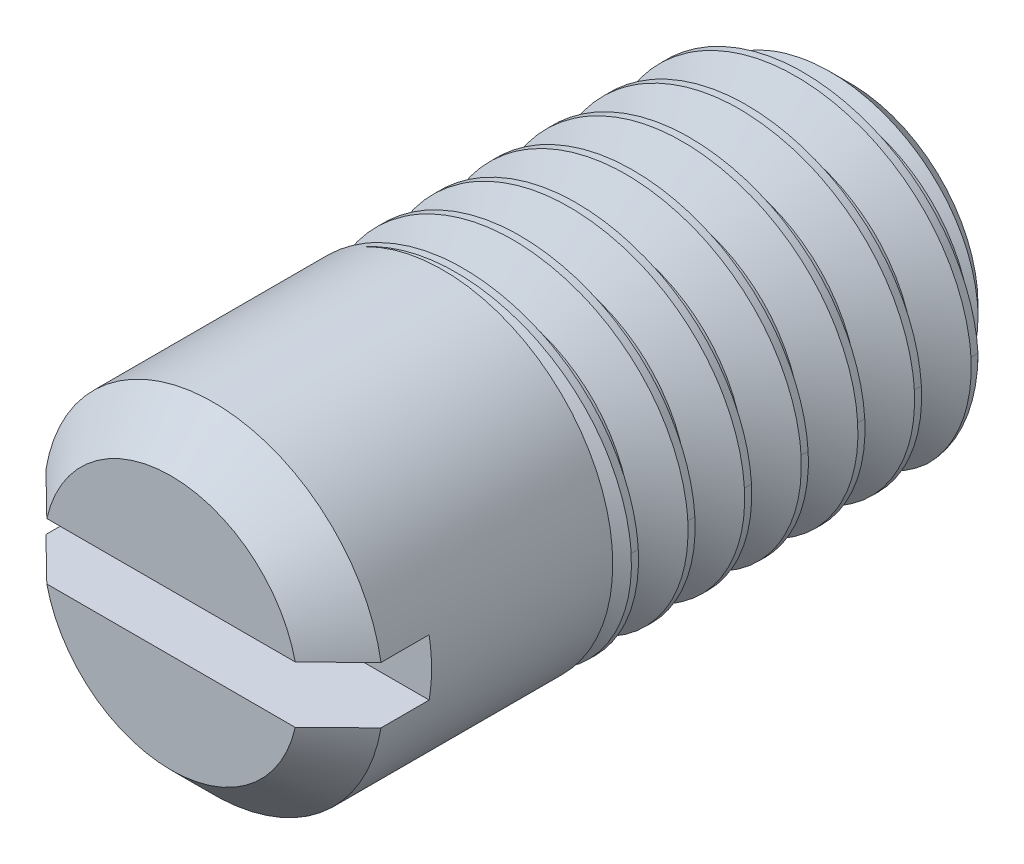
from build123d import *
from build123d.topology import SkipClean

# Parameters (mm, degrees)
SKETCH2_W               = 6
SKETCH2_H               = 1.5
CHAMFER2_SIZE           = 0.375
CUT_EXTRUDE1_DEPTH      = 5.178516483
CUT_EXTRUDE1_DEPTH_BACK = 5.178516483
SKETCH3_W               = 0.8
SKETCH3_H               = 0.5
CUT_SWEEP1_PITCH        = 0.5
BOSS_EXTRUDE2_START     = 0.5
SKETCH6_R               = 1.5
BOSS_EXTRUDE2_DEPTH     = 0.5


with BuildPart() as part:
    # Sketch2 → Revolve1 (revolve)
    with BuildSketch(Plane(origin=(0, 0, 0), x_dir=(0, 0, -1), z_dir=(1, 0, 0)), mode=Mode.PRIVATE) as revolve1_sk:
        with Locations((0.6, 0.75)):
            Rectangle(SKETCH2_W, SKETCH2_H)
    revolve(revolve1_sk.sketch.rotate(Axis((0, 0, 2.4), (0, 0, -1)), 90), axis=Axis((0, 0, 2.4), (0, 0, -1)))

    # Chamfer2
    chamfer2_edges = [part.edges().sort_by_distance(p)[0] for p in [
        (-1.5, 0, 2.4),
        (-1.5, 0, -3.6),
    ]]
    chamfer(chamfer2_edges, length=CHAMFER2_SIZE)

    # Sketch3 → Cut-Extrude1 (cut, two sides: drawn at the far end of the back side and taken through both)
    with BuildSketch(Plane(origin=(0, 0, 0), x_dir=(0, 0, -1), z_dir=(1, 0, 0)).offset(-CUT_EXTRUDE1_DEPTH_BACK)):
        with Locations((-2, 0)):
            Rectangle(SKETCH3_W, SKETCH3_H)
    extrude(amount=CUT_EXTRUDE1_DEPTH + CUT_EXTRUDE1_DEPTH_BACK, mode=Mode.SUBTRACT)

    # Cut-Sweep1: the profile of Sketch5 profile screwed along a right-hand helix of 8.2 turns, 6 arcs to a turn; built about Z, then put on its axis
    cut_sweep1_z = Axis((0, 0, 0), (0, 0, 1))
    cut_sweep1_corners = [(1.5003, 0, 0.000173205), (1.5003, 0, -0.437673205), (1.175240474, 0, -0.25), (1.175240474, 0, -0.1875)]
    with BuildLine(mode=Mode.PRIVATE) as cut_sweep1_profile:
        Line(cut_sweep1_corners[0], cut_sweep1_corners[1])
        Line(cut_sweep1_corners[1], cut_sweep1_corners[2])
        Line(cut_sweep1_corners[2], cut_sweep1_corners[3])
        Line(cut_sweep1_corners[3], cut_sweep1_corners[0])
    cut_sweep1_cap = Face(cut_sweep1_profile.wire())
    cut_sweep1_turn_angles = [0, 30, 60, 90, 120, 150, 180, 210, 240, 270, 300, 330, 360]
    cut_sweep1_turn_weights = [1, 0.8660254037844387, 1, 0.8660254037844387, 1, 0.8660254037844387, 1, 0.8660254037844387, 1, 0.8660254037844387, 1, 0.8660254037844387, 1]
    cut_sweep1_turn_rails = [Edge.make_bspline([Vector(p[0], p[1], 0).rotate(cut_sweep1_z, cut_sweep1_turn_angles[k]) / cut_sweep1_turn_weights[k] + Vector(0, 0, p[2] + CUT_SWEEP1_PITCH * cut_sweep1_turn_angles[k] / 360) for k in range(13)], [0, 0, 0, 1, 1, 2, 2, 3, 3, 4, 4, 5, 5, 6, 6, 6], 2, cut_sweep1_turn_weights) for p in cut_sweep1_corners]
    cut_sweep1_turn_sides = [Face.make_surface_from_curves(cut_sweep1_turn_rails[p[0]], cut_sweep1_turn_rails[p[1]]) for p in [(0, 1), (1, 2), (2, 3), (3, 0)]]
    cut_sweep1_last_angles = [2880, 2910, 2940, 2946, 2952]
    cut_sweep1_last_weights = [1, 0.8660254037844387, 1, 0.9945218953682684, 1]
    cut_sweep1_last_rails = [Edge.make_bspline([Vector(p[0], p[1], 0).rotate(cut_sweep1_z, cut_sweep1_last_angles[k]) / cut_sweep1_last_weights[k] + Vector(0, 0, p[2] + CUT_SWEEP1_PITCH * cut_sweep1_last_angles[k] / 360) for k in range(5)], [0, 0, 0, 1, 1, 2, 2, 2], 2, cut_sweep1_last_weights) for p in cut_sweep1_corners]
    cut_sweep1_last_sides = [Face.make_surface_from_curves(cut_sweep1_last_rails[p[0]], cut_sweep1_last_rails[p[1]]) for p in [(0, 1), (1, 2), (2, 3), (3, 0)]]
    cut_sweep1 = Plane(origin=(0, 0, -3.6), x_dir=(0, 1, 0), z_dir=(0, 0, 1)) * Solid(Shell([*[p.moved(Location((0, 0, CUT_SWEEP1_PITCH * i))) for i in range(8) for p in cut_sweep1_turn_sides], *cut_sweep1_last_sides, cut_sweep1_cap, cut_sweep1_cap.rotate(cut_sweep1_z, 2952).moved(Location((0, 0, CUT_SWEEP1_PITCH * 2952 / 360)))]))
    add(cut_sweep1, mode=Mode.SUBTRACT)

    # Sketch6 → Boss-Extrude2 (add)
    with SkipClean():  # the faces are left unmerged after this step: merging them gives an invalid solid
        with BuildSketch(Plane.XY.offset(BOSS_EXTRUDE2_START)):
            Circle(SKETCH6_R)
        extrude(amount=-BOSS_EXTRUDE2_DEPTH)


solid = part.part
